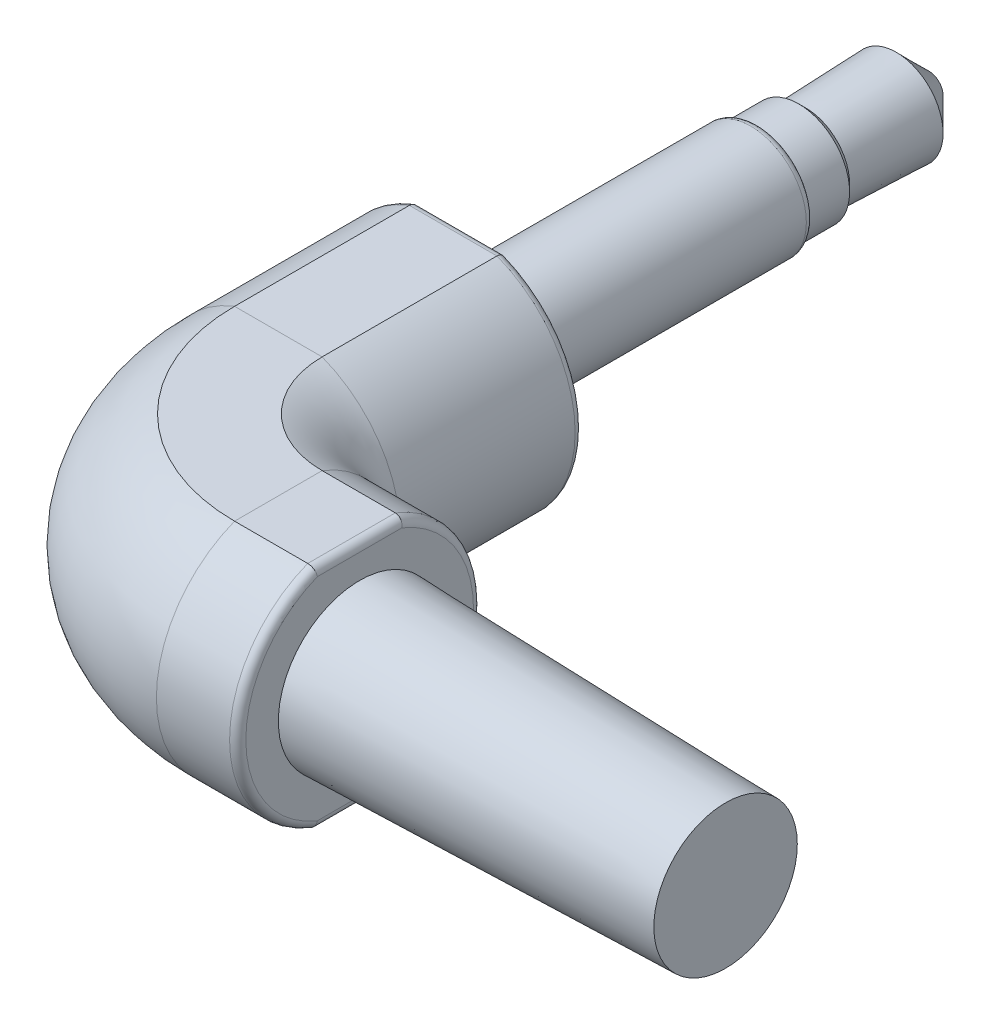
from build123d import *

# Parameters (mm, degrees)
SKETCH1_R           = 1.4605
BOSS_EXTRUDE1_DEPTH = 14.605
CHAMFER1_SIZE       = 1.016
SKETCH2_R           = 1.5875
BOSS_EXTRUDE2_DEPTH = 10.795
SKETCH3_R           = 1.7399
BOSS_EXTRUDE3_DEPTH = 9.271
FILLET1_R           = 0.254
SKETCH5_R           = 2.2225
BOSS_EXTRUDE4_DEPTH = 0.762
SKETCH8_R           = 2.54
BOSS_EXTRUDE5_DEPTH = 11.43
BOSS_EXTRUDE5_TAPER = 1.5
FILLET2_R           = 0.254


with BuildPart() as part:
    # Sketch1 → Boss-Extrude1 (new body)
    with BuildSketch(Plane.XY):
        Circle(SKETCH1_R)
    extrude(amount=-BOSS_EXTRUDE1_DEPTH)

    # Chamfer1
    chamfer1_edges = [part.edges().sort_by_distance(p)[0] for p in [
        (-1.4605, 0, -14.605),
    ]]
    chamfer(chamfer1_edges, length=CHAMFER1_SIZE)

    # Sketch4 → Cut-Revolve1 (revolve, cut)
    with BuildSketch(Plane(origin=(0, 0, 0), x_dir=(1, 0, 0), z_dir=(0, 1, 0))):
        Polygon((1.4605, 13.589), (0.985961663, 0), (2.040319949, 0), (2.040319949, 13.589), align=None)
    revolve(axis=Axis((0, 0, 1000), (0, 0, -1)), mode=Mode.SUBTRACT)

    # Sketch2 → Boss-Extrude2 (add)
    with BuildSketch(Plane.XY):
        Circle(SKETCH2_R)
    extrude(amount=-BOSS_EXTRUDE2_DEPTH)

    # Chamfer2: read off the stored shape, not the designer's step
    # Chamfer2 outline → Chamfer2 (revolve, cut)
    with BuildSketch(Plane.XZ):
        Polygon((1.361938283, -10.766561717), (1.36293137, -10.766561717), (1.36293137, -10.795), (1.5875, -10.795), (1.5875, -10.541), align=None)
    revolve(axis=Axis((0, 0, 0), (0, 0, 1)), mode=Mode.SUBTRACT)

    # Sketch3 → Boss-Extrude3 (add)
    with BuildSketch(Plane.XY):
        Circle(SKETCH3_R)
    extrude(amount=-BOSS_EXTRUDE3_DEPTH)

    # Fillet1
    # the kernel refuses this fillet: 0.254 mm, written as the material it takes off along each edge
    with BuildSketch(Plane(origin=(0, 0, -9.271), x_dir=(1, 0, 0), z_dir=(0, -1, 0))) as fillet1_piece_1:
        with BuildLine():
            CenterArc((1.4859, 0.232794845), FILLET1_R, 293.578178478, 66.421821522)
            Line((1.7399, 0.232794845), (1.74498, 0.232794845))
            Line((1.74498, 0.232794845), (1.74498, 0))
            Line((1.74498, 0), (1.7399, -0.00508))
            ThreePointArc((1.7399, -0.00508), (1.6637, -0.00508), (1.589532, -0.004655897))
            Line((1.589532, -0.004655897), (1.5875, 0))
        make_face()
    revolve(axis=Axis((0, 0, -9.271), (0, 0, 1)), mode=Mode.SUBTRACT)

    # Sketch5 → Boss-Extrude4 (add)
    with BuildSketch(Plane.XY):
        Circle(SKETCH5_R)
    extrude(amount=-BOSS_EXTRUDE4_DEPTH)

    # Sweep2: sweep along a path in Sketch7
    with BuildLine(Plane(origin=(0, 0, 0), x_dir=(1, 0, 0), z_dir=(0, 1, 0))) as sweep2_path:
        Line((0, 0), (0, -5.715))
        ThreePointArc((0, -5.715), (1.301910358, -8.858089642), (4.445, -10.16))
        Line((4.445, -10.16), (6.985, -10.16))
    # Sketch6 → Sweep2 (sweep)
    with BuildSketch(Plane.XY):
        with BuildLine():
            Line((-1.367831861, 3.556), (1.367831861, 3.556))
            ThreePointArc((1.367831861, 3.556), (3.81, 0), (1.367831861, -3.556))
            Line((1.367831861, -3.556), (-1.367831861, -3.556))
            ThreePointArc((-1.367831861, -3.556), (-3.81, 0), (-1.367831861, 3.556))
        make_face()
    sweep(path=sweep2_path.line)

    # Sketch8 → Boss-Extrude5 (add)
    with BuildSketch(Plane(origin=(6.985, 0, 0), x_dir=(0, 0, -1), z_dir=(1, 0, 0))):
        with Locations((-10.16, 0)):
            Circle(SKETCH8_R)
    extrude(amount=BOSS_EXTRUDE5_DEPTH, taper=BOSS_EXTRUDE5_TAPER)

    # Fillet2
    fillet2_edges = [part.edges().sort_by_distance(p)[0] for p in [
        (6.985, 0, 13.97),
        (6.985, -3.556, 10.16),
        (6.985, 0, 6.35),
        (6.985, 3.556, 10.16),
        (-3.81, 0, 0),
        (0, -3.556, 0),
        (3.81, 0, 0),
        (0, 3.556, 0),
    ]]
    fillet(fillet2_edges, radius=FILLET2_R - 0.0001)  # a hair under: the kernel refuses the full size


solid = part.part
